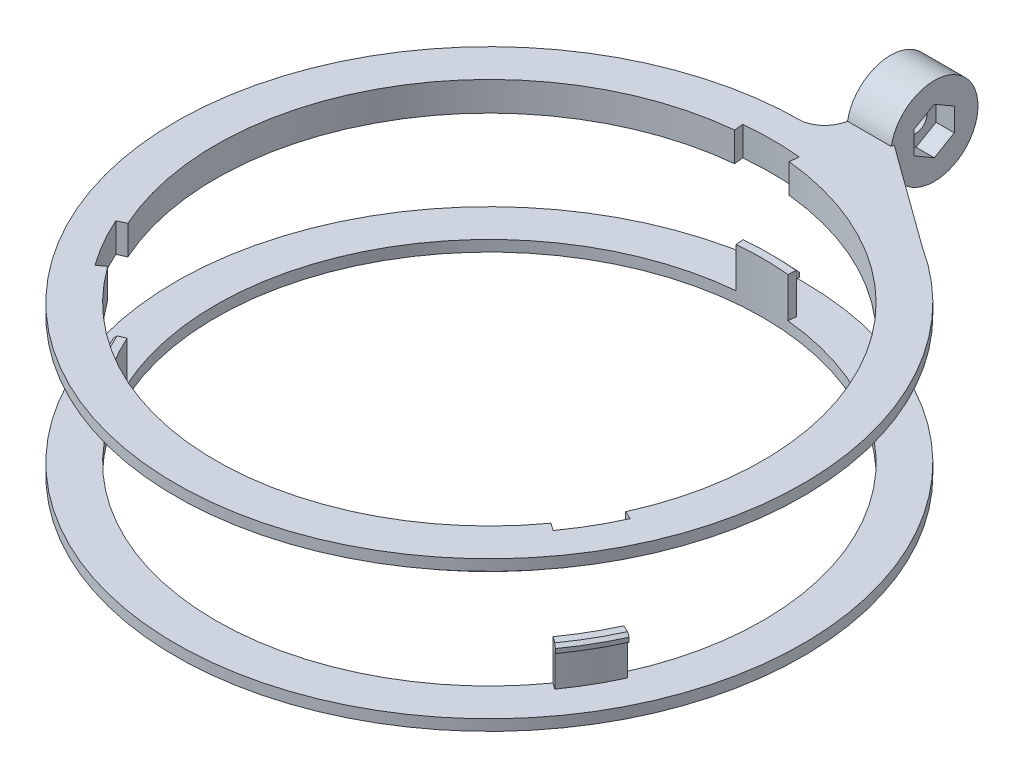
from build123d import *
from build123d.topology import SkipClean

# Parameters (mm, degrees)
ESBO_O120_R                = 6
RESSALTO_EXTRUS_O39_DEPTH  = 6
ESBO_O120_3_W              = 10
ESBO_O120_3_H              = 0.75
ESBO_O120_3_W_2            = 0.75
ESBO_O120_3_H_2            = 10
CORTE_EXTRUS_O_FINA1_DEPTH = 0.4
CORTE_EXTRUS_O49_REACH     = 205.931
ESBO_O120_4_R              = 1.5
CORTE_EXTRUS_O50_DEPTH     = 2.5
RESSALTO_EXTRUS_O40_DEPTH  = 1.5
RESSALTO_EXTRUS_O41_START  = -2.5
ESBO_O122_12_R             = 39.5
RESSALTO_EXTRUS_O41_DEPTH  = 2.5
ESBO_O123_R                = 43
ESBO_O123_R_2              = 37.5
RESSALTO_EXTRUS_O42_DEPTH  = 1.5
RESSALTO_EXTRUS_O43_DEPTH  = 5.5
RESSALTO_EXTRUS_O44_DEPTH  = 1
CHANFRO1_SIZE              = 0.4


with BuildPart() as part:
    # Esboço120 → Ressalto-extrusão39 (new body)
    with BuildSketch(Plane(origin=(10, 0, 0), x_dir=(0, 0, -1), z_dir=(1, 0, 0))):
        with Locations((-76, 180.622055231)):
            Circle(ESBO_O120_R)
    extrude(amount=RESSALTO_EXTRUS_O39_DEPTH)

    # Esboço120<3> → Corte-Extrusão-Fina1 (cut)
    with BuildSketch(Plane(origin=(10, 0, 0), x_dir=(0, 0, -1), z_dir=(1, 0, 0))):
        Polygon((-78.824759526, 184.76468225), (-73.824759526, 176.104428212), (-73.175240474, 176.479428212), (-78.175240474, 185.13968225), align=None)
        Polygon((-78.175240474, 176.104428212), (-73.175240474, 184.76468225), (-73.824759526, 185.13968225), (-78.824759526, 176.479428212), align=None)
        Polygon((-80.142627019, 177.797295704), (-71.482372981, 182.797295704), (-71.857372981, 183.446814757), (-80.517627019, 178.446814757), align=None)
        with Locations((-76, 180.622055231)):
            Rectangle(ESBO_O120_3_W, ESBO_O120_3_H)
        Polygon((-71.482372981, 178.446814757), (-80.142627019, 183.446814757), (-80.517627019, 182.797295704), (-71.857372981, 177.797295704), align=None)
        with Locations((-76, 180.622055231)):
            Rectangle(ESBO_O120_3_W_2, ESBO_O120_3_H_2)
    extrude(amount=CORTE_EXTRUS_O_FINA1_DEPTH, mode=Mode.SUBTRACT)

    # Esboço120<4> → Corte-extrusão49 (cut, up to next)
    with BuildSketch(Plane(origin=(10, 0, 0), x_dir=(0, 0, -1), z_dir=(1, 0, 0)), mode=Mode.PRIVATE) as corte_extrus_o49_sk1:
        with Locations(Location((-76, 180.622055231, 0), (0, 0, 165.522487814))):
            Circle(ESBO_O120_4_R)
    corte_extrus_o49_tool1 = extrude(corte_extrus_o49_sk1.sketch, amount=CORTE_EXTRUS_O49_REACH, mode=Mode.PRIVATE) & part.part
    add(corte_extrus_o49_tool1.solids().sort_by_distance((10, 180.622055, 76))[0], mode=Mode.SUBTRACT)

    # Esboço121 → Corte-extrusão50 (cut)
    with BuildSketch(Plane(origin=(16, 0, 0), x_dir=(0, 0, -1), z_dir=(1, 0, 0))):
        Polygon((-76, 183.797481711), (-78.75, 182.209768471), (-78.75, 179.03434199), (-76, 177.44662875), (-73.25, 179.03434199), (-73.25, 182.209768471), align=None)
    extrude(amount=-CORTE_EXTRUS_O50_DEPTH, mode=Mode.SUBTRACT)

    # Esboço122 → Ressalto-extrusão40 (add)
    with BuildSketch(Plane(origin=(0, 180.233826663, 0), x_dir=(1, 0, 0), z_dir=(0, 1, 0))):
        with BuildLine():
            Line((10, -81.5), (10, -82))
            add(Edge.make_bspline(
                [(10, -82), (9.391813157, -84.399749478), (7, -85)],
                knots=[0, 0, 0, 1, 1, 1], degree=2))
            ThreePointArc((7, -85), (-5.028043514, -169.28348543), (30.095793449, -91.729015385))
            Line((30.095793449, -91.729015385), (16, -81.5))
            Line((16, -81.5), (10, -81.5))
        make_face()
        with BuildLine():
            ThreePointArc((10.807751981, -90.693820554), (39.505758511, -109.301720303), (41.162914828, -143.464321855))
            Line((41.162914828, -143.464321855), (42.301678656, -143.97979925))
            ThreePointArc((42.301678656, -143.97979925), (40.527599963, -147.428395218), (38.417697232, -150.682389659))
            Line((38.417697232, -150.682389659), (37.404223128, -149.95069967))
            ThreePointArc((37.404223128, -149.95069967), (6.940305969, -165.499952488), (-23.473952993, -149.853791181))
            Line((-23.473952993, -149.853791181), (-24.489751426, -150.582250887))
            ThreePointArc((-24.489751426, -150.582250887), (-26.589283795, -147.321555687), (-28.352374279, -143.867329102))
            Line((-28.352374279, -143.867329102), (-27.211975109, -143.355479776))
            ThreePointArc((-27.211975109, -143.355479776), (-25.44606448, -109.198327209), (3.311038165, -90.681886964))
            Line((3.311038165, -90.681886964), (3.18807277, -89.437949863))
            ThreePointArc((3.18807277, -89.437949863), (7.061683832, -89.250049095), (10.934677047, -89.450281239))
            Line((10.934677047, -89.450281239), (10.807751981, -90.693820554))
        make_face(mode=Mode.SUBTRACT)
    extrude(amount=RESSALTO_EXTRUS_O40_DEPTH)

    # Esboço122<12> → Ressalto-extrusão41 (add)
    with BuildSketch(Plane(origin=(0, 180.233826663, 0), x_dir=(1, 0, 0), z_dir=(0, 1, 0)).offset(RESSALTO_EXTRUS_O41_START)):
        with Locations(Location((7, -128, 0), (0, 0, 270))):
            Circle(ESBO_O122_12_R)
        with BuildLine():
            Line((10.934677047, -89.450281239), (10.807751981, -90.693820554))
            ThreePointArc((10.807751981, -90.693820554), (34.830205706, -102.865767361), (44.5, -128))
            ThreePointArc((44.5, -128), (43.656236209, -135.910142032), (41.162914828, -143.464321855))
            Line((41.162914828, -143.464321855), (42.301678656, -143.97979925))
            ThreePointArc((42.301678656, -143.97979925), (40.527599963, -147.428395218), (38.417697232, -150.682389659))
            Line((38.417697232, -150.682389659), (37.404223128, -149.95069967))
            ThreePointArc((37.404223128, -149.95069967), (6.940305969, -165.499952488), (-23.473952993, -149.853791181))
            Line((-23.473952993, -149.853791181), (-24.489751426, -150.582250887))
            ThreePointArc((-24.489751426, -150.582250887), (-26.589283795, -147.321555687), (-28.352374279, -143.867329102))
            Line((-28.352374279, -143.867329102), (-27.211975109, -143.355479776))
            ThreePointArc((-27.211975109, -143.355479776), (-25.44606448, -109.198327209), (3.311038165, -90.681886964))
            Line((3.311038165, -90.681886964), (3.18807277, -89.437949863))
            ThreePointArc((3.18807277, -89.437949863), (7.061683832, -89.250049095), (10.934677047, -89.450281239))
        make_face(mode=Mode.SUBTRACT)
    extrude(amount=RESSALTO_EXTRUS_O41_DEPTH)


with BuildPart() as body_2:
    # Esboço123 → Ressalto-extrusão42 (new body)
    with BuildSketch(Plane(origin=(0, 162.733826663, 0), x_dir=(-1, 0, 0), z_dir=(0, -1, 0))):
        with Locations(Location((-7, -128, 0), (0, 0, 90))):
            Circle(ESBO_O123_R)
        with Locations(Location((-7, -128, 0), (0, 0, 90))):
            Circle(ESBO_O123_R_2, mode=Mode.SUBTRACT)
    extrude(amount=RESSALTO_EXTRUS_O42_DEPTH)

    # Esboço123<3> → Ressalto-extrusão43 (add)
    with SkipClean():  # the faces are left unmerged after this step: merging them gives an invalid solid
        with BuildSketch(Plane(origin=(0, 162.733826663, 0), x_dir=(-1, 0, 0), z_dir=(0, -1, 0))):
            with BuildLine():
                ThreePointArc((-37.520861107, -149.788231623), (-39.44606448, -146.801672791), (-41.079952569, -143.646304129))
                Line((-41.079952569, -143.646304129), (-42.036527418, -144.079311132))
                ThreePointArc((-42.036527418, -144.079311132), (-40.354554285, -147.32811963), (-38.372191133, -150.402859717))
                Line((-38.372191133, -150.402859717), (-37.520861107, -149.788231623))
            make_face()
            with BuildLine():
                Line((28.087541199, -143.967684635), (27.129592643, -143.537725253))
                ThreePointArc((27.129592643, -143.537725253), (25.505758511, -146.698279697), (23.590073136, -149.69095262))
                Line((23.590073136, -149.69095262), (24.443355624, -150.302867239))
                ThreePointArc((24.443355624, -150.302867239), (26.415919749, -147.221831528), (28.087541199, -143.967684635))
            make_face()
            with BuildLine():
                Line((-10.715350066, -89.629455648), (-10.608731536, -90.674043124))
                ThreePointArc((-10.608731536, -90.674043124), (-7.059694031, -90.500047512), (-3.510120567, -90.662743251))
                Line((-3.510120567, -90.662743251), (-3.406828206, -89.61782163))
                ThreePointArc((-3.406828206, -89.61782163), (-7.061365464, -89.450048842), (-10.715350066, -89.629455648))
            make_face()
        extrude(amount=-RESSALTO_EXTRUS_O43_DEPTH)

    # Esboço124 → Ressalto-extrusão44 (add)
    with SkipClean():  # the faces are left unmerged after this step: merging them gives an invalid solid
        with BuildSketch(Plane(origin=(0, 168.233826663, 0), x_dir=(1, 0, 0), z_dir=(0, 1, 0))):
            with BuildLine():
                Line((38.372191133, -150.402859717), (38.69771322, -150.635314812))
                ThreePointArc((38.69771322, -150.635314812), (40.70064564, -147.528670806), (42.400071153, -144.246152233))
                Line((42.400071153, -144.246152233), (42.036527418, -144.079311132))
                ThreePointArc((42.036527418, -144.079311132), (40.354554285, -147.32811963), (38.372191133, -150.402859717))
            make_face()
            with BuildLine():
                Line((10.715350066, -89.629455648), (10.75390104, -89.231317704))
                ThreePointArc((10.75390104, -89.231317704), (7.0620022, -89.050049349), (3.369544971, -89.219562969))
                Line((3.369544971, -89.219562969), (3.406828206, -89.61782163))
                ThreePointArc((3.406828206, -89.61782163), (7.061365464, -89.450048842), (10.715350066, -89.629455648))
            make_face()
            with BuildLine():
                Line((-28.087541199, -143.967684635), (-28.45161426, -144.133367484))
                ThreePointArc((-28.45161426, -144.133367484), (-26.76264784, -147.421279845), (-24.769616124, -150.534284798))
                Line((-24.769616124, -150.534284798), (-24.443355624, -150.302867239))
                ThreePointArc((-24.443355624, -150.302867239), (-26.415919749, -147.221831528), (-28.087541199, -143.967684635))
            make_face()
        extrude(amount=-RESSALTO_EXTRUS_O44_DEPTH)

    # Chanfro1
    chanfro1_edges = [body_2.edges().sort_by_distance(p)[0] for p in [
        (40.70064564, 168.233826663, 147.528670806),
        (-26.76264784, 168.233826663, 147.421279845),
        (7.0620022, 168.233826663, 89.050049349),
    ]]
    chamfer(chanfro1_edges, length=CHANFRO1_SIZE - 0.0001)  # a hair under: the kernel refuses the full size


solid = Compound([part.part, body_2.part])
